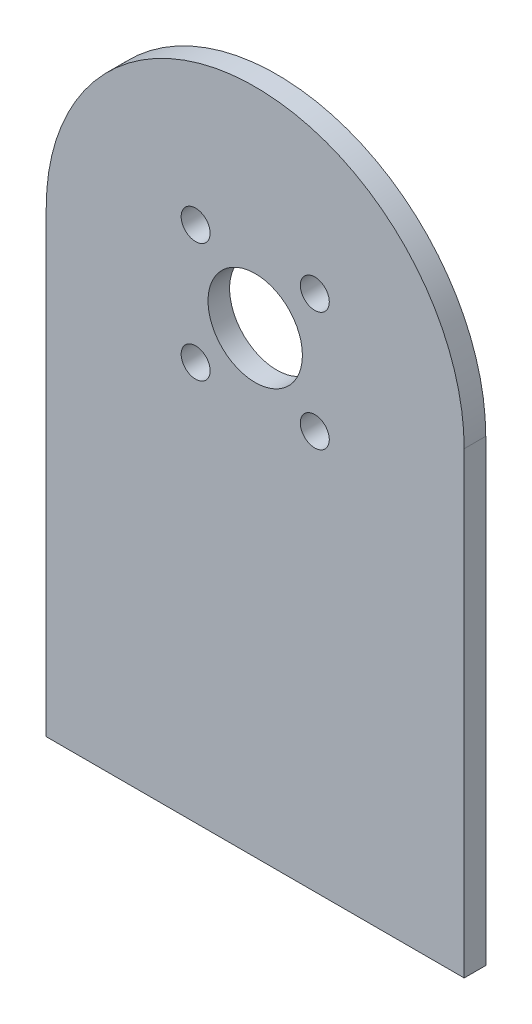
from build123d import *

# Parameters (mm, degrees)
SKETCH1_W           = 150
SKETCH1_H           = 160
BOSS_EXTRUDE1_DEPTH = 3.2
CUT_EXTRUDE1_REACH  = 111.705
SKETCH2_R           = 7
SKETCH3_R           = 2.15
CUT_EXTRUDE2_DEPTH  = 110.705241443
CIRPATTERN1_COUNT   = 4
SKETCH5_OUTSIDE_W   = 195.868
SKETCH5_OUTSIDE_H   = 205.868
CUT_EXTRUDE4_DEPTH  = 10


with BuildPart() as part:
    # Sketch1 → Boss-Extrude1 (new body)
    with BuildSketch(Plane.XY):
        Rectangle(SKETCH1_W, SKETCH1_H)
    extrude(amount=BOSS_EXTRUDE1_DEPTH)

    # Sketch2 → Cut-Extrude1 (cut, up to next)
    with BuildSketch(Plane.XY.offset(3.2), mode=Mode.PRIVATE) as cut_extrude1_sk1:
        with Locations((0, -12)):
            Circle(SKETCH2_R)
    cut_extrude1_tool1 = extrude(cut_extrude1_sk1.sketch, amount=-CUT_EXTRUDE1_REACH, mode=Mode.PRIVATE) & part.part
    add(cut_extrude1_tool1.solids().sort_by_distance((0, -12, 3.2))[0], mode=Mode.SUBTRACT)

    # Sketch3 → Cut-Extrude2 (cut, through all)
    with BuildSketch(Plane.XY.offset(3.2)):
        with Locations((-8.838834765, -3.161165235)):
            Circle(SKETCH3_R)
    cut_extrude2 = extrude(amount=-CUT_EXTRUDE2_DEPTH, mode=Mode.SUBTRACT)

    # CirPattern1: Cut-Extrude2 ×4 about axis
    cirpattern1_axis = Axis((0, -12, 3.2), (0, 0, 1))
    for i in range(1, CIRPATTERN1_COUNT):
        add(cut_extrude2.rotate(cirpattern1_axis, i * 360 / CIRPATTERN1_COUNT), mode=Mode.SUBTRACT)

    # Sketch5 outside → Cut-Extrude4 (cut)
    with BuildSketch(Plane.XY.offset(3.2)):
        Rectangle(SKETCH5_OUTSIDE_W, SKETCH5_OUTSIDE_H)
        with BuildLine():
            Line((-31, -80), (31, -80))
            Line((31, -80), (31, -12))
            ThreePointArc((31, -12), (0, 19), (-31, -12))
            Line((-31, -12), (-31, -80))
        make_face(mode=Mode.SUBTRACT)
    extrude(amount=-CUT_EXTRUDE4_DEPTH, mode=Mode.SUBTRACT)


solid = part.part
